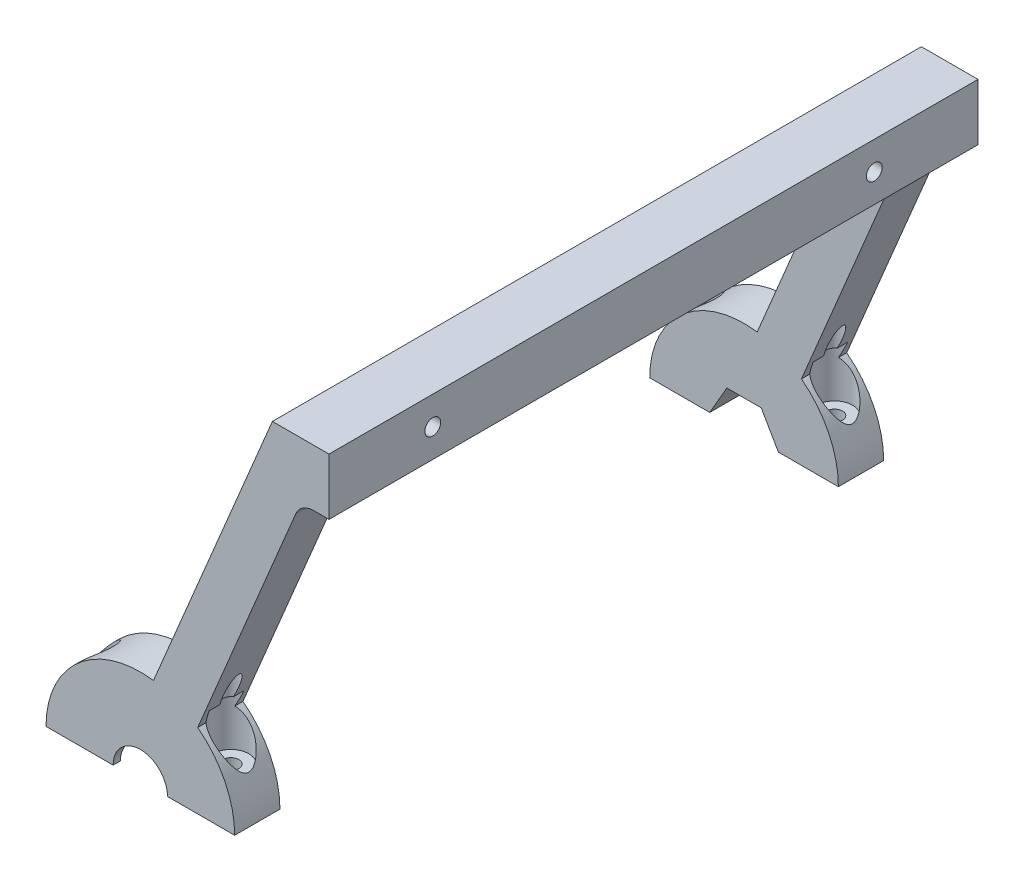
from build123d import *

# Parameters (mm, degrees)
SKETCH1_W           = 15
SKETCH1_H           = 15
BOSS_EXTRUDE1_DEPTH = 86
BOSS_EXTRUDE2_DEPTH = 12
SKETCH3_R           = 6
CUT_EXTRUDE1_DEPTH  = 5
SKETCH4_R           = 2.1
CUT_EXTRUDE2_DEPTH  = 135.726016512
BOSS_EXTRUDE5_DEPTH = 12
CUT_EXTRUDE4_START  = -10
SKETCH8_R           = 4.75
CUT_EXTRUDE4_DEPTH  = 14
SKETCH6_R           = 2.1
CUT_EXTRUDE5_DEPTH  = 149.162917192
FILLET1_R           = 5
CUT_EXTRUDE6_REACH  = 208.631
SKETCH9_R           = 7.2
CUT_EXTRUDE7_START  = -1.925
SKETCH10_R          = 13.1
CUT_EXTRUDE7_DEPTH  = 8.15
CUT_EXTRUDE8_REACH  = 208.631
SKETCH13_W          = 293.713713594
SKETCH13_H          = 183.479930123
CUT_EXTRUDE9_DEPTH  = 147.891967278


# Read off the part's stored shape, not the designer's step: Mirror6
with BuildPart() as part:
    # Sketch1 → Boss-Extrude1 (new body)
    with BuildSketch(Plane.XY):
        Rectangle(SKETCH1_W, SKETCH1_H)
    extrude(amount=BOSS_EXTRUDE1_DEPTH)

    # Sketch2 → Boss-Extrude2 (add)
    with BuildSketch(Plane.XY.offset(86)):
        Polygon((7.5, 7.5), (49.391891892, -92.5), (35.608108108, -92.5), (0, -7.5), align=None)
    extrude(amount=-BOSS_EXTRUDE2_DEPTH)

    # Sketch3 → Cut-Extrude1 (cut)
    with BuildSketch(Plane(origin=(7.5, 0, 0), x_dir=(0, 0, -1), z_dir=(1, 0, 0))):
        with Locations((-58.5, 0)):
            Circle(SKETCH3_R)
    extrude(amount=-CUT_EXTRUDE1_DEPTH, mode=Mode.SUBTRACT)

    # Sketch4 → Cut-Extrude2 (cut, through all)
    with BuildSketch(Plane(origin=(2.5, 0, 0), x_dir=(0, 0, -1), z_dir=(1, 0, 0))):
        with Locations((-58.5, 0)):
            Circle(SKETCH4_R)
    extrude(amount=-CUT_EXTRUDE2_DEPTH, mode=Mode.SUBTRACT)

    # Sketch5 → Boss-Extrude5 (add)
    with BuildSketch(Plane.XY.offset(86)):
        with BuildLine():
            Line((17.5, -92.5), (67.5, -92.5))
            ThreePointArc((67.5, -92.5), (42.5, -67.5), (17.5, -92.5))
        make_face()
    extrude(amount=-BOSS_EXTRUDE5_DEPTH)

    # Sketch8 → Cut-Extrude4 (cut)
    with BuildSketch(Plane(origin=(0, -72.655502084, 0), x_dir=(1, 0, 0), z_dir=(0, 1, 0)).offset(CUT_EXTRUDE4_START)):
        with Locations(Location((24.5, -80, 0), (0, 0, 76.371804965))):
            Circle(SKETCH8_R)
        with Locations(Location((60.5, -80, 0), (0, 0, 90))):
            Circle(SKETCH8_R)
    extrude(amount=CUT_EXTRUDE4_DEPTH, mode=Mode.SUBTRACT)

    # Sketch6 → Cut-Extrude5 (cut, through all)
    with BuildSketch(Plane.XZ.offset(92.5)):
        with Locations(Location((24.5, 80, 0), (0, 0, 270))):
            Circle(SKETCH6_R)
        with Locations(Location((60.5, 80, 0), (0, 0, 90))):
            Circle(SKETCH6_R)
    extrude(amount=-CUT_EXTRUDE5_DEPTH, mode=Mode.SUBTRACT)

    # Fillet1
    fillet1_edges = [part.edges().sort_by_distance(p)[0] for p in [
        (3.75, -7.5, 74),
        (7.5, 0, 74),
        (0, -7.5, 80),
    ]]
    fillet(fillet1_edges, radius=FILLET1_R)

    # Mirror2: part across plane


with BuildPart() as part_1:
    add(part.part)
    add(part.part.mirror(Plane(origin=(0, 0, 0), x_dir=(1, 0, 0), z_dir=(0, 0, -1))))

    # Sketch9 → Cut-Extrude6 (cut, up to next)
    with BuildSketch(Plane.XY.offset(86), mode=Mode.PRIVATE) as cut_extrude6_sk1:
        with Locations((42.5, -92.5)):
            Circle(SKETCH9_R)
    cut_extrude6_tool1 = extrude(cut_extrude6_sk1.sketch, amount=-CUT_EXTRUDE6_REACH, mode=Mode.PRIVATE) & part_1.part
    add(cut_extrude6_tool1.solids().sort_by_distance((42.5, -92.5, 86))[0], mode=Mode.SUBTRACT)

    # Sketch10 → Cut-Extrude7 (cut)
    with BuildSketch(Plane.XY.offset(86).offset(CUT_EXTRUDE7_START)):
        with Locations((42.5, -92.5)):
            Circle(SKETCH10_R)
    extrude(amount=-CUT_EXTRUDE7_DEPTH, mode=Mode.SUBTRACT)

    # Sketch11 → Cut-Extrude8 (cut, up to next)
    with BuildSketch(Plane(origin=(0, 0, -86), x_dir=(-1, 0, 0), z_dir=(0, 0, -1)), mode=Mode.PRIVATE) as cut_extrude8_sk1:
        Polygon((-33.4, -92.5), (-37.95, -84.619168826), (-47.05, -84.619168826), (-51.6, -92.5), (-47.05, -100.380831174), (-37.95, -100.380831174), align=None)
    cut_extrude8_tool1 = extrude(cut_extrude8_sk1.sketch, amount=-CUT_EXTRUDE8_REACH, mode=Mode.PRIVATE) & part_1.part
    add(cut_extrude8_tool1.solids().sort_by_distance((42.5, -92.5, -86))[0], mode=Mode.SUBTRACT)

    # Mirror6: part across plane


with BuildPart() as part_2:
    add(part_1.part)
    add(part_1.part.mirror(Plane(origin=(-7.5, -7.5, 86), x_dir=(0, 0, 1), z_dir=(1, 0, 0))))

    # Sketch13 → Cut-Extrude9 (cut, through all)
    with BuildSketch(Plane(origin=(-7.5, 0, 0), x_dir=(0, 0, -1), z_dir=(1, 0, 0))):
        with Locations((0, -49.790062979)):
            Rectangle(SKETCH13_W, SKETCH13_H)
    extrude(amount=CUT_EXTRUDE9_DEPTH, mode=Mode.SUBTRACT)


solid = part_2.part
